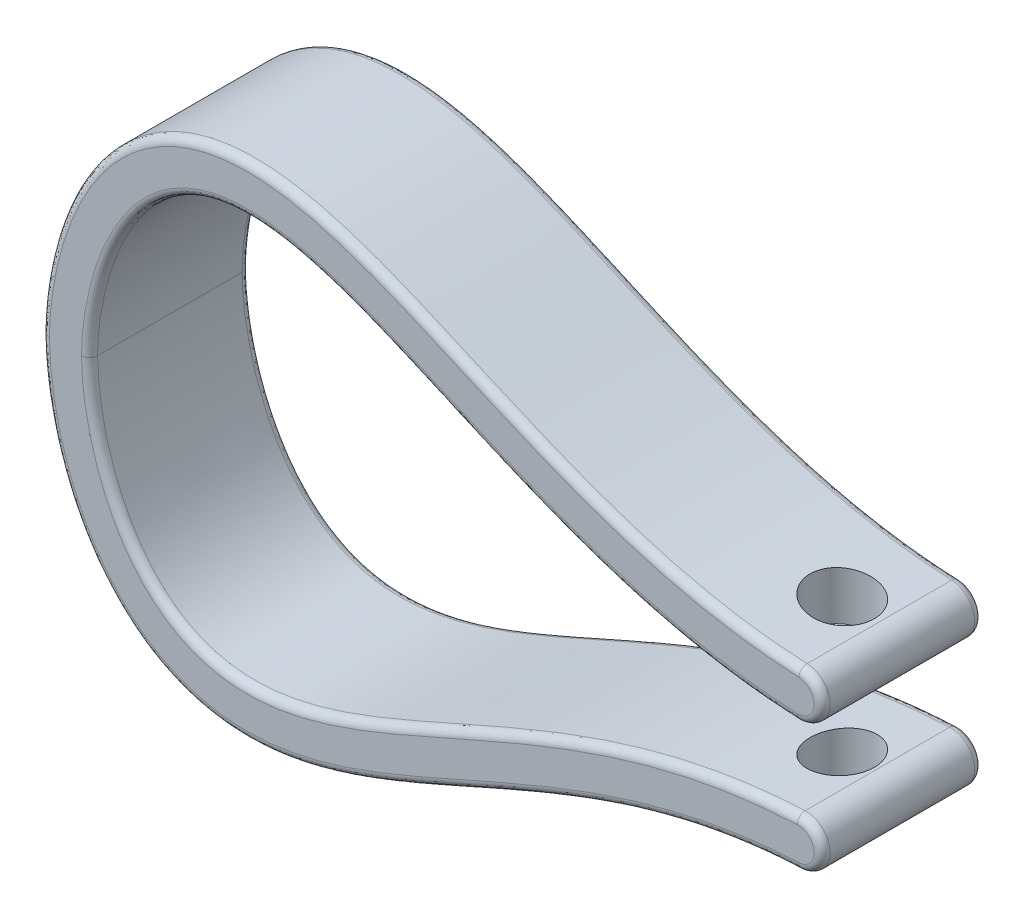
from build123d import *

# Parameters (mm, degrees)
BOSS_EXTRUDE1_DEPTH     = 10
CUT_EXTRUDE1_DEPTH      = 50.249509326
CUT_EXTRUDE1_DEPTH_BACK = 50.249509326
SKETCH5_R               = 2
FILLET5_R               = 0.5
FILLET6_R               = 0.5


# Read off the part's stored shape, not the designer's step: Boss-Extrude1
with BuildPart() as part:
    # Boss-Extrude1 outline → Boss-Extrude1 (new body)
    with BuildSketch(Plane(origin=(0, 0, 0), x_dir=(0, 1, 0), z_dir=(0, 0, 1))):
        with BuildLine():
            ThreePointArc((-5.497332474, -44.195258343), (-3.935424563, -45.630682906), (-2.5, -44.068774995))
            add(Edge.make_bspline(
                [(-2.5, -44.068774995), (-3.515313629, -20.008433889), (-23.406198933, -10.022130085), (-10.626809639, -0.158369807), (0, 0)],
                knots=[0, 0, 0, 0, 0, 1, 1, 1, 1, 1], degree=4))
            add(Edge.make_bspline(
                [(0, 0), (10.626809639, -0.158369807), (23.406198933, -10.022130085), (3.515313629, -20.008433889), (2.5, -44.068774995)],
                knots=[0, 0, 0, 0, 0, 1, 1, 1, 1, 1], degree=4))
            ThreePointArc((2.5, -44.068774995), (3.935424563, -45.630682906), (5.497332474, -44.195258343))
            add(Edge.make_bspline(
                [(5.497332474, -44.195258343), (5.516668622, -43.737041), (5.573252054, -42.813431413), (5.748304107, -41.034188564), (6.074998553, -38.88722966), (6.608785972, -36.435591268), (7.47221995, -33.313682633), (8.7684602, -29.666107862), (10.472053934, -25.637515829), (12.146781116, -21.906659433), (14.133774411, -17.259774772), (15.49343617, -12.975662767), (15.684574021, -8.808337342), (15.072743101, -5.791533616), (13.65386997, -3.092893521), (10.893965352, -0.16520745), (6.337820328, 2.228057036), (2.092723695, 2.969145566), (0, 3.000333124)],
                knots=[-0.00105167, -0.00105167, -0.00105167, -0.00105167, 0.014589762, 0.030231194, 0.061514059, 0.092796924, 0.124079788, 0.186645518, 0.249211247, 0.311776977, 0.374342706, 0.499474165, 0.562039894, 0.624605624, 0.687171353, 0.749737082, 0.874868541, 1, 1, 1, 1], degree=3))
            add(Edge.make_bspline(
                [(0, 3.000333124), (-2.092723695, 2.969145566), (-6.337820328, 2.228057036), (-10.893965352, -0.16520745), (-13.65386997, -3.092893521), (-15.072743101, -5.791533616), (-15.684574021, -8.808337342), (-15.49343617, -12.975662767), (-14.133774411, -17.259774772), (-12.146781116, -21.906659433), (-10.472053934, -25.637515829), (-8.7684602, -29.666107862), (-7.47221995, -33.313682633), (-6.608785972, -36.435591268), (-6.074998553, -38.88722966), (-5.748304107, -41.034188564), (-5.573252054, -42.813431413), (-5.516668622, -43.737041), (-5.497332474, -44.195258343)],
                knots=[-0.00105167, -0.00105167, -0.00105167, -0.00105167, 0.124079788, 0.249211247, 0.311776977, 0.374342706, 0.436908435, 0.499474165, 0.624605624, 0.687171353, 0.749737082, 0.812302812, 0.874868541, 0.906151406, 0.937434271, 0.968717135, 0.984358568, 1, 1, 1, 1], degree=3))
        make_face()
    extrude(amount=BOSS_EXTRUDE1_DEPTH)

    # Sketch5 → Cut-Extrude1 (cut, two sides: drawn at the far end of the back side and taken through both)
    with BuildSketch(Plane(origin=(0, 0, 0), x_dir=(-1, 0, 0), z_dir=(0, 1, 0)).offset(-CUT_EXTRUDE1_DEPTH_BACK)):
        with Locations(Location((-41.881295976, 5, 0), (0, 0, 90))):
            Circle(SKETCH5_R)
    extrude(amount=CUT_EXTRUDE1_DEPTH + CUT_EXTRUDE1_DEPTH_BACK, mode=Mode.SUBTRACT)

    # Fillet5
    fillet5_edges = [part.edges().sort_by_distance(p)[0] for p in [
        (45.630682906, -3.935424563, 0),
        (18.55928241, -10.305049424, 0),
        (18.559532794, 10.304945395, 0),
        (45.630682906, 3.935424563, 0),
        (18.559532794, 10.304945395, 0),
        (18.55928241, -10.305049424, 0),
    ]]
    fillet(fillet5_edges, radius=FILLET5_R)

    # Fillet6
    fillet6_edges = [part.edges().sort_by_distance(p)[0] for p in [
        (45.630682906, 3.935424563, 10),
        (18.559532794, 10.304945395, 10),
        (18.55928241, -10.305049424, 10),
        (45.630682906, -3.935424563, 10),
        (18.55928241, -10.305049424, 10),
        (18.559532794, 10.304945395, 10),
    ]]
    fillet(fillet6_edges, radius=FILLET6_R)


solid = part.part
